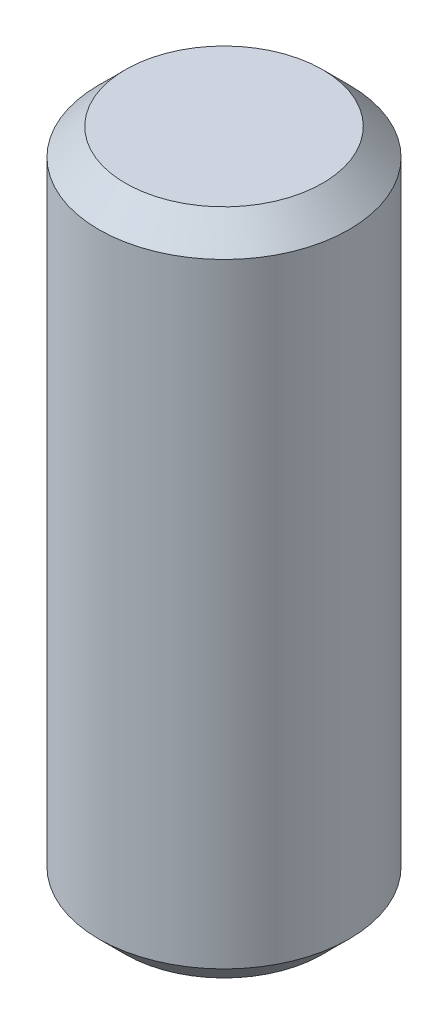
from build123d import *

# Parameters (mm, degrees)
SKETCH1_W     = 1.190625
SKETCH1_H     = 6.35
CHAMFER1_SIZE = 0.254


with BuildPart() as part:
    # Sketch1 → Revolve1 (revolve)
    with BuildSketch(Plane.XY):
        with Locations((0.5953125, 0)):
            Rectangle(SKETCH1_W, SKETCH1_H)
    revolve(axis=Axis((0, 0.760475273, 0), (0, -1, 0)))

    # Chamfer1
    chamfer1_edges = [part.edges().sort_by_distance(p)[0] for p in [
        (-1.190625, -3.175, 0),
        (-1.190625, 3.175, 0),
    ]]
    chamfer(chamfer1_edges, length=CHAMFER1_SIZE)


solid = part.part
